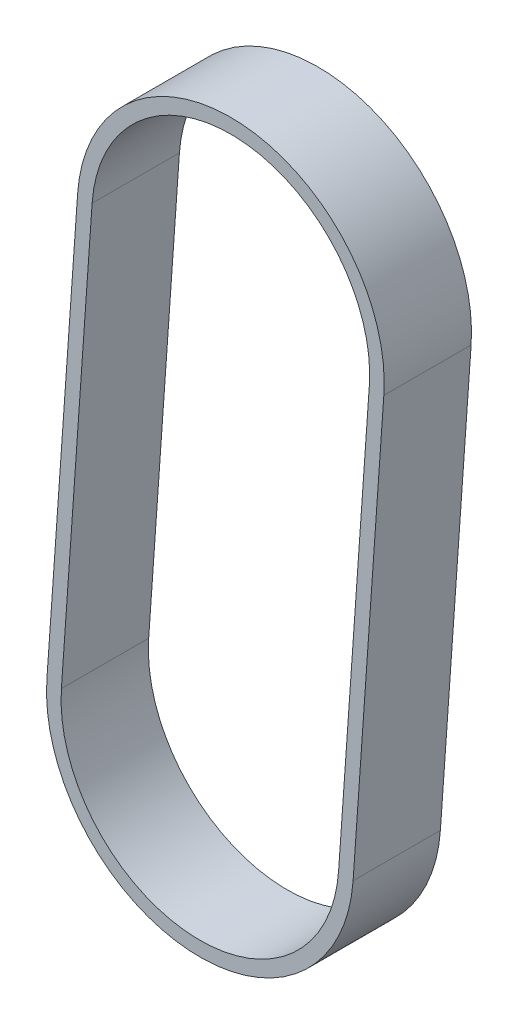
from build123d import *

# Parameters (mm, degrees)
EXTRUDE_THIN1_DEPTH = 9


with BuildPart() as part:
    # Sketch2 → Extrude-Thin1 (new body)
    with BuildSketch(Plane.XY):
        with BuildLine():
            Line((15.784725347, -1.113407935), (12.616201005, -46.033409794))
            ThreePointArc((12.616201005, -46.033409794), (-4.281932279, -60.704727208), (-18.953249693, -43.806593923))
            Line((-18.953249693, -43.806593923), (-15.784725347, 1.113407936))
            ThreePointArc((-15.784725347, 1.113407936), (1.113407935, 15.784725348), (15.784725347, -1.113407935))
        make_face()
        with BuildLine():
            Line((14.288443086, -1.007864601), (11.119918744, -45.92786646))
            ThreePointArc((11.119918744, -45.92786646), (-4.176388945, -59.208444947), (-17.456967432, -43.912137257))
            Line((-17.456967432, -43.912137257), (-14.288443086, 1.007864602))
            ThreePointArc((-14.288443086, 1.007864602), (1.007864601, 14.288443087), (14.288443086, -1.007864601))
        make_face(mode=Mode.SUBTRACT)
    extrude(amount=EXTRUDE_THIN1_DEPTH)


solid = part.part
